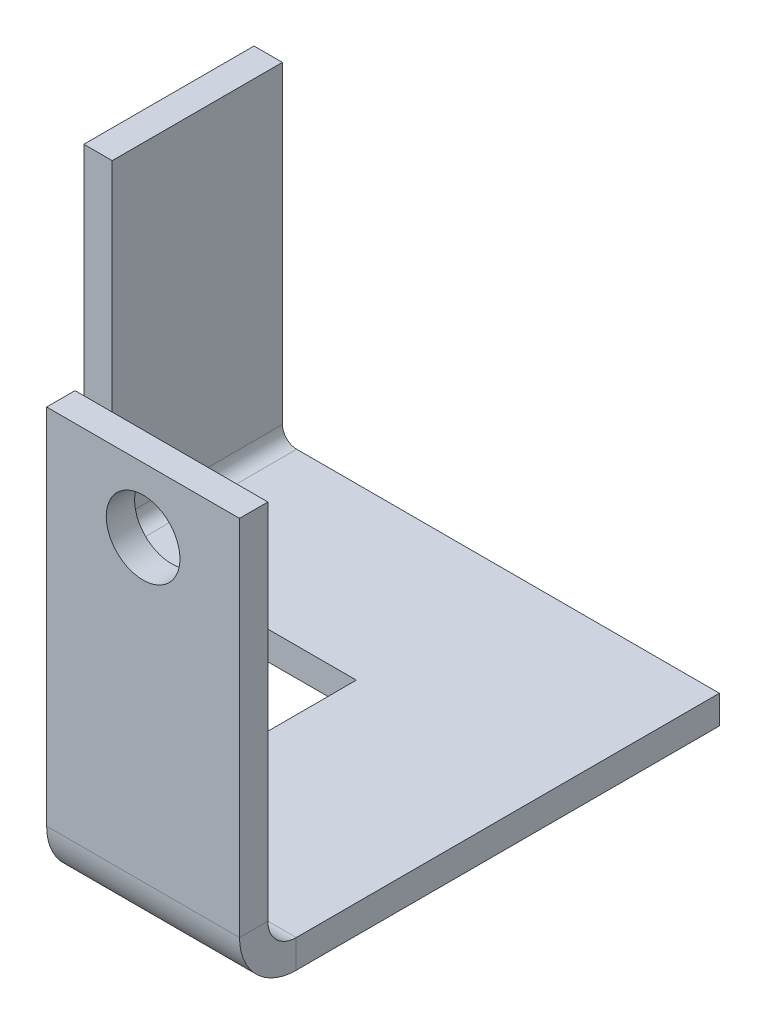
from build123d import *

# Parameters (mm, degrees)
SKETCH1_W                    = 21.59
SKETCH1_H                    = 46.99
SKETCH1_R                    = 4.124999878
BOSS_EXTRUDE1_DEPTH          = 3.175
EDGE_FLANGE2_STRIP_W         = 19.05
EDGE_FLANGE2_STRIP_H         = 3.175
EDGE_FLANGE2_STRIP_CUT_DEPTH = 21.59
EDGE_FLANGE2_DEPTH           = 21.59
EDGE_FLANGE2_FLAT_DEPTH      = 3.175
EDGE_FLANGE3_STRIP_W         = 15.900000204
EDGE_FLANGE3_STRIP_H         = 3.175
EDGE_FLANGE3_STRIP_CUT_DEPTH = 19.05
EDGE_FLANGE3_DEPTH           = 19.05


# Sheet-metal steps are written as plain solids
with BuildPart() as part:
    # Sketch1 → Boss-Extrude1 (new body)
    with BuildSketch(Plane.XY):
        with Locations((10.795, 23.495)):
            Rectangle(SKETCH1_W, SKETCH1_H)
        with Locations(Location((10.795, 39.729801599, 0), (0, 0, 180))):
            Circle(SKETCH1_R, mode=Mode.SUBTRACT)
    extrude(amount=BOSS_EXTRUDE1_DEPTH)

    # Edge-Flange2 strip (across the edge) → Edge-Flange2 strip cut (cut)
    with BuildSketch(Plane(origin=(21.59, 0, 0), x_dir=(0, 1, 0), z_dir=(-1, 0, 0))):
        with Locations((-3.175, -1.5875)):
            Rectangle(EDGE_FLANGE2_STRIP_W, EDGE_FLANGE2_STRIP_H)
    extrude(amount=EDGE_FLANGE2_STRIP_CUT_DEPTH, mode=Mode.SUBTRACT)

    # Edge-Flange2 bend section (across the edge) → Edge-Flange2 (add)
    with BuildSketch(Plane(origin=(21.59, 0, 0), x_dir=(0, 1, 0), z_dir=(-1, 0, 0))):
        with BuildLine():
            Line((0, 3.175), (3.175, 3.175))
            ThreePointArc((3.175, 3.175), (4.10493597, 0.92993597), (6.35, 0))
            Line((6.35, 0), (6.35, -3.175))
            ThreePointArc((6.35, -3.175), (1.859871939, -1.315128061), (0, 3.175))
        make_face()
    extrude(amount=EDGE_FLANGE2_DEPTH)

    # Edge-Flange2 profile (on flange) → Edge-Flange2 flat (add)
    with BuildSketch(Plane(origin=(0, 0, 0), x_dir=(-1, 0, 0), z_dir=(0, -1, 0))):
        Polygon((0, 3.175), (0, 31.493260102), (27.326645128, 31.493260102), (27.326645128, 50.543260102), (0, 50.543260102), (-21.59, 50.543260102), (-21.59, 3.175), align=None)
    extrude(amount=-EDGE_FLANGE2_FLAT_DEPTH)

    # Edge-Flange3 strip (across the edge) → Edge-Flange3 strip cut (cut)
    with BuildSketch(Plane(origin=(-27.326645128, 3.175, -50.543260102), x_dir=(1, 0, 0), z_dir=(0, 0, 1))):
        with Locations((-6.35, -1.5875)):
            Rectangle(EDGE_FLANGE3_STRIP_W, EDGE_FLANGE3_STRIP_H)
    extrude(amount=EDGE_FLANGE3_STRIP_CUT_DEPTH, mode=Mode.SUBTRACT)

    # Edge-Flange3 section (across the edge) → Edge-Flange3 (add)
    with BuildSketch(Plane(origin=(-27.326645128, 3.175, -50.543260102), x_dir=(1, 0, 0), z_dir=(0, 0, 1))):
        with BuildLine():
            Line((-3.175, 1.600000102), (-3.175, 36.703))
            Line((-3.175, 36.703), (0, 36.703))
            Line((0, 36.703), (0, 1.600000102))
            ThreePointArc((0, 1.600000102), (0.46862918, 0.46862918), (1.600000102, 0))
            Line((1.600000102, 0), (1.600000102, -3.175))
            ThreePointArc((1.600000102, -3.175), (-1.77643485, -1.77643485), (-3.175, 1.600000102))
        make_face()
    extrude(amount=EDGE_FLANGE3_DEPTH)


solid = part.part
